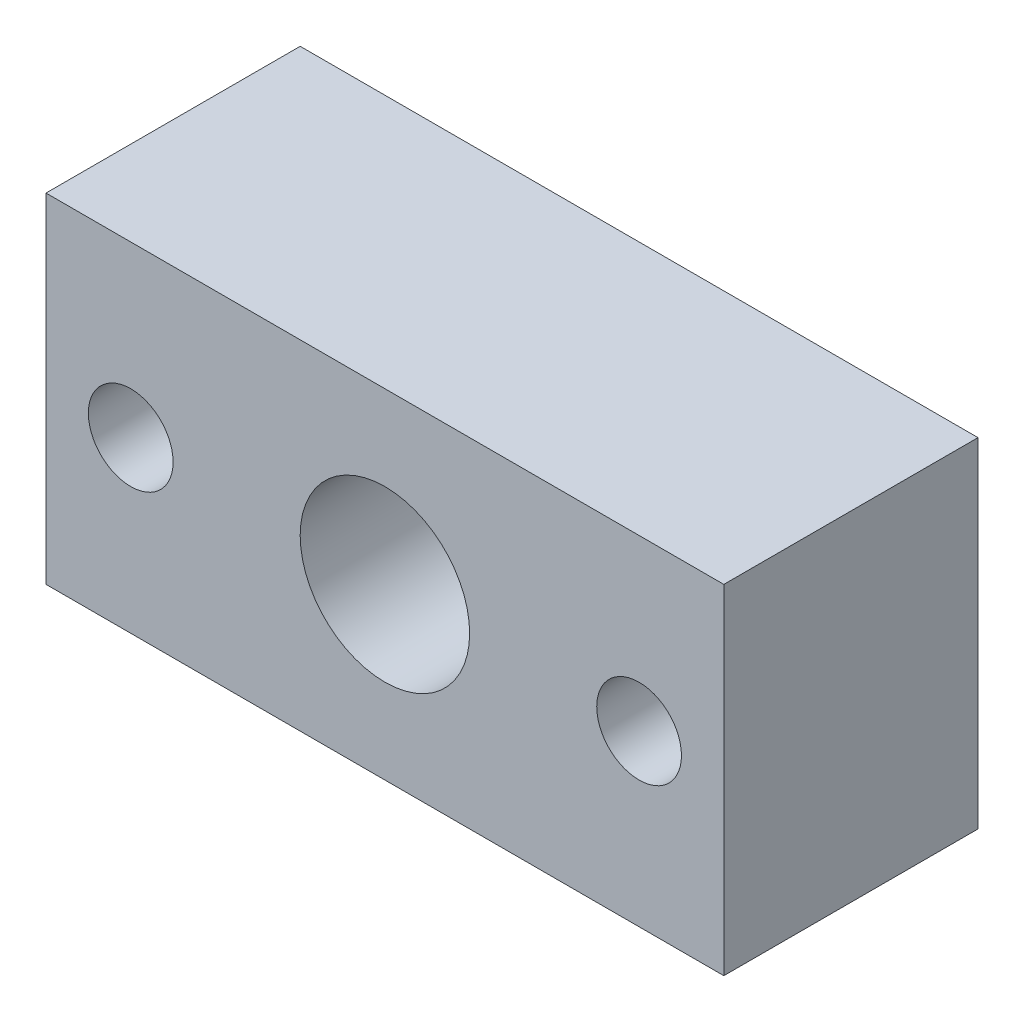
from build123d import *

# Parameters (mm, degrees)
SKETCH1_W           = 40
SKETCH1_H           = 20
SKETCH1_R           = 5
SKETCH1_R_2         = 2.5
BOSS_EXTRUDE1_DEPTH = 15
SKETCH3_R           = 4.15
CUT_EXTRUDE1_DEPTH  = 5


with BuildPart() as part:
    # Sketch1 → Boss-Extrude1 (new body)
    with BuildSketch(Plane.XY):
        with Locations((20, 10)):
            Rectangle(SKETCH1_W, SKETCH1_H)
        with Locations((20, 10)):
            Circle(SKETCH1_R, mode=Mode.SUBTRACT)
        with Locations((35, 10)):
            Circle(SKETCH1_R_2, mode=Mode.SUBTRACT)
        with Locations((5, 10)):
            Circle(SKETCH1_R_2, mode=Mode.SUBTRACT)
    extrude(amount=BOSS_EXTRUDE1_DEPTH)

    # Sketch3 → Cut-Extrude1 (cut)
    with BuildSketch(Plane(origin=(0, 0, 0), x_dir=(-1, 0, 0), z_dir=(0, 0, -1))):
        with Locations((-5, 10)):
            Circle(SKETCH3_R)
        with Locations((-35, 10)):
            Circle(SKETCH3_R)
    extrude(amount=-CUT_EXTRUDE1_DEPTH, mode=Mode.SUBTRACT)


solid = part.part
